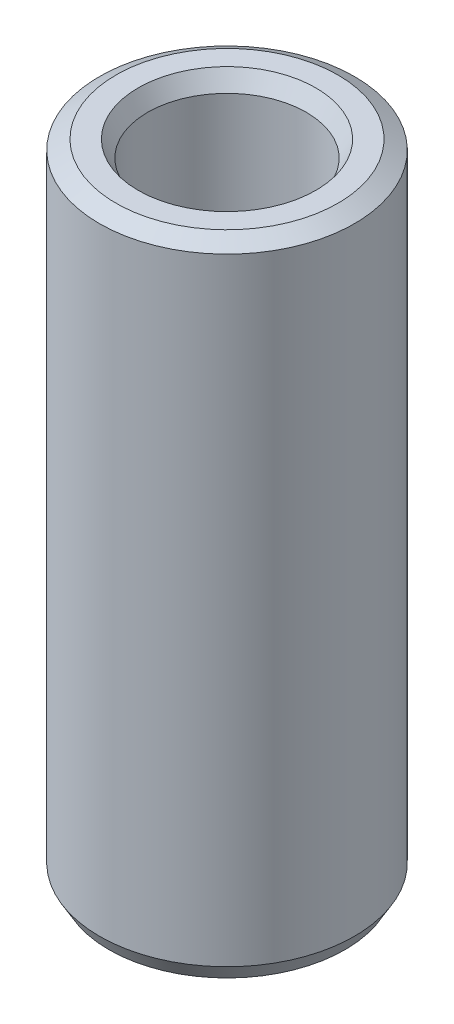
from build123d import *
from OCP.BRepFilletAPI import BRepFilletAPI_MakeChamfer

# Parameters (mm, degrees)
SKETCH1_R           = 50
BOSS_EXTRUDE1_DEPTH = 252.187879163
SKETCH2_R           = 31.115618338
CUT_EXTRUDE1_DEPTH  = 262.913585743
CHAMFER1_SIZE       = 3.722010592
CHAMFER1_SIZE2      = 6.446711452


with BuildPart() as part:
    # Sketch1 → Boss-Extrude1 (new body)
    with BuildSketch(Plane(origin=(0, 0, 0), x_dir=(1, 0, 0), z_dir=(0, 1, 0))):
        Circle(SKETCH1_R)
    extrude(amount=BOSS_EXTRUDE1_DEPTH)

    # Sketch2 → Cut-Extrude1 (cut, through all)
    with BuildSketch(Plane(origin=(0, 0, 0), x_dir=(1, 0, 0), z_dir=(0, 1, 0))):
        Circle(SKETCH2_R)
    extrude(amount=CUT_EXTRUDE1_DEPTH, mode=Mode.SUBTRACT)

    # Chamfer1: one chamfer whose edges measure the first distance from different faces: ONE call of the kernel's chamfer builder (chamfer() names one face for all edges)
    chamfer1_edges_1 = [part.edges().sort_by_distance(p)[0] for p in [
        (-31.115618338, 252.187879163, 0),
    ]]
    chamfer1_side_1 = [part.faces().sort_by_distance(p)[0] for p in [
        (-48.585786438, 252.187879163, 0),
    ]]
    chamfer1_edges_2 = [part.edges().sort_by_distance(p)[0] for p in [
        (-31.115618338, 0, 0),
    ]]
    chamfer1_side_2 = [part.faces().sort_by_distance(p)[0] for p in [
        (-31.115618338, 126.093939582, 0),
    ]]
    chamfer1_edges_3 = [part.edges().sort_by_distance(p)[0] for p in [
        (-50, 0, 0),
    ]]
    chamfer1_side_3 = [part.faces().sort_by_distance(p)[0] for p in [
        (-48.585786438, 0, 0),
    ]]
    chamfer1_edges_4 = [part.edges().sort_by_distance(p)[0] for p in [
        (-50, 252.187879163, 0),
    ]]
    chamfer1_side_4 = [part.faces().sort_by_distance(p)[0] for p in [
        (-50, 126.093939582, 0),
    ]]
    chamfer1 = BRepFilletAPI_MakeChamfer(part.part.solid().wrapped)
    for e in chamfer1_edges_1:
        chamfer1.Add(CHAMFER1_SIZE, CHAMFER1_SIZE2, e.wrapped, chamfer1_side_1[0].wrapped)  # the first distance lies on this face
    for e in chamfer1_edges_2:
        chamfer1.Add(CHAMFER1_SIZE, CHAMFER1_SIZE2, e.wrapped, chamfer1_side_2[0].wrapped)  # the first distance lies on this face
    for e in chamfer1_edges_3:
        chamfer1.Add(CHAMFER1_SIZE, CHAMFER1_SIZE2, e.wrapped, chamfer1_side_3[0].wrapped)  # the first distance lies on this face
    for e in chamfer1_edges_4:
        chamfer1.Add(CHAMFER1_SIZE, CHAMFER1_SIZE2, e.wrapped, chamfer1_side_4[0].wrapped)  # the first distance lies on this face
    add(Compound.cast(chamfer1.Shape()), mode=Mode.REPLACE)


solid = part.part
